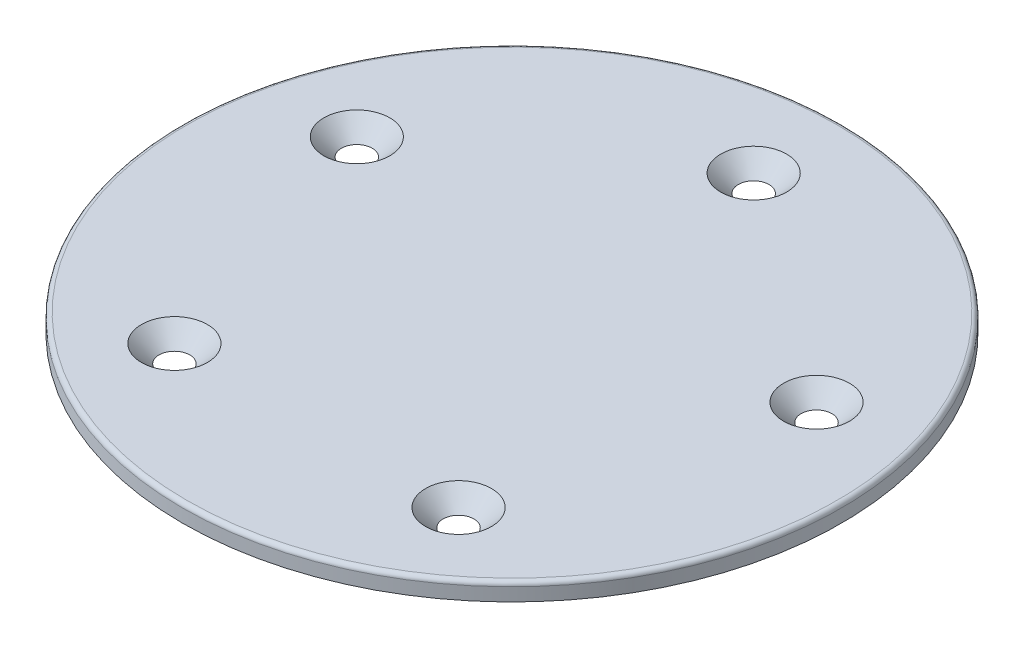
from build123d import *

# Parameters (mm, degrees)
SKETCH2_R           = 37.5
SKETCH2_R_2         = 1.75
BOSS_EXTRUDE1_DEPTH = 2
CHAMFER1_SIZE       = 2
FILLET1_R           = 0.5


with BuildPart() as part:
    # Sketch2 → Boss-Extrude1 (new body)
    with BuildSketch(Plane(origin=(0, 0, 0), x_dir=(1, 0, 0), z_dir=(0, 1, 0))):
        with Locations(Location((0, 0, 0), (0, 0, 270))):
            Circle(SKETCH2_R)
        with Locations(Location((0, 27.5, 0), (0, 0, 270))):
            Circle(SKETCH2_R_2, mode=Mode.SUBTRACT)
        with Locations(Location((26.154054198, 8.497967345, 0), (0, 0, 270))):
            Circle(SKETCH2_R_2, mode=Mode.SUBTRACT)
        with Locations(Location((16.164094438, -22.247967345, 0), (0, 0, 270))):
            Circle(SKETCH2_R_2, mode=Mode.SUBTRACT)
        with Locations(Location((-16.164094438, -22.247967345, 0), (0, 0, 270))):
            Circle(SKETCH2_R_2, mode=Mode.SUBTRACT)
        with Locations(Location((-26.154054198, 8.497967345, 0), (0, 0, 270))):
            Circle(SKETCH2_R_2, mode=Mode.SUBTRACT)
    extrude(amount=BOSS_EXTRUDE1_DEPTH)

    # Chamfer1
    chamfer1_edges = [part.edges().sort_by_distance(p)[0] for p in [
        (-26.154054198, 2, -10.247967345),
        (0, 2, -29.25),
        (26.154054198, 2, -10.247967345),
        (16.164094438, 2, 20.497967345),
        (-16.164094438, 2, 20.497967345),
    ]]
    chamfer(chamfer1_edges, length=CHAMFER1_SIZE - 0.0001)  # a hair under: the kernel refuses the full size

    # Fillet1
    fillet1_edges = [part.edges().sort_by_distance(p)[0] for p in [
        (0, 2, -37.5),
    ]]
    fillet(fillet1_edges, radius=FILLET1_R)


solid = part.part
